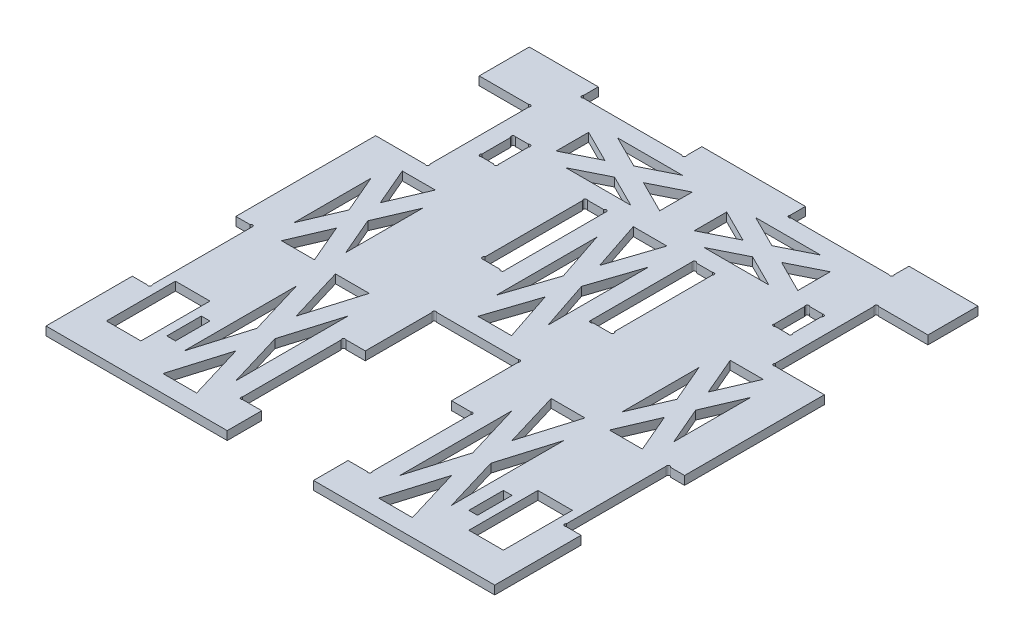
from build123d import *

# Parameters (mm, degrees)
SKETCH1_W           = 330.2
SKETCH1_H           = 355.6
BOSS_EXTRUDE1_DEPTH = 6.35
SKETCH2_W           = 63.5
SKETCH2_H           = 152.4
CUT_EXTRUDE1_DEPTH  = 243.716238641
SKETCH3_W           = 25.4
SKETCH3_H           = 76.2
SKETCH3_W_2         = 12.7
SKETCH3_H_2         = 25.4
CUT_EXTRUDE2_DEPTH  = 243.716238641
SKETCH4_W           = 12.7
SKETCH4_H           = 76.2
SKETCH4_W_2         = 76.2
SKETCH4_H_2         = 12.7
SKETCH4_W_3         = 15.875
CUT_EXTRUDE3_DEPTH  = 243.716238641
SKETCH5_W           = 25.4
SKETCH5_H           = 50.8
SKETCH5_W_2         = 6.35
SKETCH5_H_2         = 25.4
CUT_EXTRUDE4_DEPTH  = 243.716238641
SKETCH6_R           = 1.27
CUT_EXTRUDE5_DEPTH  = 243.716238641


with BuildPart() as part:
    # Sketch1 → Boss-Extrude1 (new body)
    with BuildSketch(Plane(origin=(0, 0, 0), x_dir=(1, 0, 0), z_dir=(0, 1, 0))):
        Rectangle(SKETCH1_W, SKETCH1_H)
    extrude(amount=BOSS_EXTRUDE1_DEPTH)

    # Sketch2 → Cut-Extrude1 (cut, through all)
    with BuildSketch(Plane(origin=(0, 6.35, 0), x_dir=(1, 0, 0), z_dir=(0, 1, 0))):
        with Locations((0, -101.6)):
            Rectangle(SKETCH2_W, SKETCH2_H)
    extrude(amount=-CUT_EXTRUDE1_DEPTH, mode=Mode.SUBTRACT)

    # Sketch3 → Cut-Extrude2 (cut, through all)
    with BuildSketch(Plane(origin=(0, 6.35, 0), x_dir=(1, 0, 0), z_dir=(0, 1, 0))):
        with Locations((139.7, 102.87)):
            Rectangle(SKETCH3_W, SKETCH3_H)
        with Locations((107.95, 102.87)):
            Rectangle(SKETCH3_W_2, SKETCH3_H_2)
        with Locations((-107.95, 102.87)):
            Rectangle(SKETCH3_W_2, SKETCH3_H_2)
        with Locations((-139.7, 102.87)):
            Rectangle(SKETCH3_W, SKETCH3_H)
    extrude(amount=-CUT_EXTRUDE2_DEPTH, mode=Mode.SUBTRACT)

    # Sketch4 → Cut-Extrude3 (cut, through all)
    with BuildSketch(Plane(origin=(0, 6.35, 0), x_dir=(1, 0, 0), z_dir=(0, 1, 0))):
        with Locations((-158.75, 102.87)):
            Rectangle(SKETCH4_W, SKETCH4_H)
        with Locations((-158.75, -76.2)):
            Rectangle(SKETCH4_W, SKETCH4_H)
        with Locations((158.75, 102.87)):
            Rectangle(SKETCH4_W, SKETCH4_H)
        with Locations((158.75, -76.2)):
            Rectangle(SKETCH4_W, SKETCH4_H)
        with Locations((76.2, 171.45)):
            Rectangle(SKETCH4_W_2, SKETCH4_H_2)
        with Locations((-76.2, 171.45)):
            Rectangle(SKETCH4_W_2, SKETCH4_H_2)
        with Locations((-39.6875, -114.3)):
            Rectangle(SKETCH4_W_3, SKETCH4_H)
        with Locations((39.6875, 63.5)):
            Rectangle(SKETCH4_W_3, SKETCH4_H)
        with Locations((-39.6875, 63.5)):
            Rectangle(SKETCH4_W_3, SKETCH4_H)
        with Locations((39.6875, -114.3)):
            Rectangle(SKETCH4_W_3, SKETCH4_H)
    extrude(amount=-CUT_EXTRUDE3_DEPTH, mode=Mode.SUBTRACT)

    # Sketch5 → Cut-Extrude4 (cut, through all)
    with BuildSketch(Plane(origin=(0, 6.35, 0), x_dir=(1, 0, 0), z_dir=(0, 1, 0))):
        Polygon((-79.375, -123.698648777), (-91.795405367, -165.1), (-66.954594633, -165.1), align=None)
        Polygon((-98.425, -60.198648777), (-98.425, -143.001351223), (-86.004594633, -101.6), align=None)
        Polygon((-60.325, -60.198648777), (-72.745405367, -101.6), (-60.325, -143.001351223), align=None)
        Polygon((-91.795405367, -38.1), (-79.375, -79.501351223), (-66.954594633, -38.1), align=None)
        Polygon((-120.65, -8.500053074), (-132.791405825, -36.83), (-108.508594175, -36.83), align=None)
        Polygon((-139.7, 35.949946926), (-139.7, -20.709946926), (-127.558594175, 7.62), align=None)
        Polygon((-101.6, 35.949946926), (-113.741405825, 7.62), (-101.6, -20.709946926), align=None)
        Polygon((-132.791405825, 52.07), (-120.65, 23.740053074), (-108.508594175, 52.07), align=None)
        Polygon((-50.8, 126.250484171), (-74.700968343, 114.3), (-26.899031657, 114.3), align=None)
        Polygon((-88.9, 145.300484171), (-88.9, 121.399515829), (-64.999031657, 133.35), align=None)
        Polygon((-12.7, 145.300484171), (-36.600968343, 133.35), (-12.7, 121.399515829), align=None)
        Polygon((-74.700968343, 152.4), (-50.8, 140.449515829), (-26.899031657, 152.4), align=None)
        Polygon((0, 24.369536858), (-12.356512286, -12.7), (12.356512286, -12.7), align=None)
        Polygon((-19.05, 81.519536858), (-19.05, 7.380463142), (-6.693487714, 44.45), align=None)
        Polygon((19.05, 81.519536858), (6.693487714, 44.45), (19.05, 7.380463142), align=None)
        Polygon((-12.356512286, 101.6), (0, 64.530463142), (12.356512286, 101.6), align=None)
        with Locations((-133.35, -127)):
            Rectangle(SKETCH5_W, SKETCH5_H)
        with Locations((-111.125, -127)):
            Rectangle(SKETCH5_W_2, SKETCH5_H_2)
    cut_extrude4 = extrude(amount=-CUT_EXTRUDE4_DEPTH, mode=Mode.SUBTRACT)

    # Mirror1: Cut-Extrude4 across plane
    add(cut_extrude4.mirror(Plane(origin=(0, 0, 0), x_dir=(0, 0, 1), z_dir=(1, 0, 0))), mode=Mode.SUBTRACT)

    # Sketch6 → Cut-Extrude5 (cut, through all)
    with BuildSketch(Plane(origin=(0, 6.35, 0), x_dir=(1, 0, 0), z_dir=(0, 1, 0))):
        with Locations((-127.819401443, 65.74029958)):
            Circle(SKETCH6_R)
        with Locations((-127.938300971, 140.114142951)):
            Circle(SKETCH6_R)
        with Locations((-113.390747669, 165.986656753)):
            Circle(SKETCH6_R)
        with Locations((-39.124010483, 165.851200727)):
            Circle(SKETCH6_R)
        with Locations((-46.842435984, 100.59975325)):
            Circle(SKETCH6_R)
        with Locations((-32.940336301, 101.157281704)):
            Circle(SKETCH6_R)
        with Locations((-47.298248414, 26.627246268)):
            Circle(SKETCH6_R)
        with Locations((-32.907949838, 25.921586207)):
            Circle(SKETCH6_R)
        with Locations((-153.566823076, -38.601421888)):
            Circle(SKETCH6_R)
        with Locations((-153.151740664, -113.276385828)):
            Circle(SKETCH6_R)
        with Locations((-46.766926853, -151.463725214)):
            Circle(SKETCH6_R)
        with Locations((-46.820773943, -77.182914264)):
            Circle(SKETCH6_R)
        with Locations((-30.885953067, -26.330764684)):
            Circle(SKETCH6_R)
        with Locations((-113.677974461, 114.462758279)):
            Circle(SKETCH6_R)
        with Locations((-102.514812329, 114.689080933)):
            Circle(SKETCH6_R)
        with Locations((-102.638073114, 90.901644865)):
            Circle(SKETCH6_R)
        with Locations((-113.565600374, 91.206126049)):
            Circle(SKETCH6_R)
    cut_extrude5 = extrude(amount=-CUT_EXTRUDE5_DEPTH, mode=Mode.SUBTRACT)

    # Mirror2: Cut-Extrude5 across plane
    add(cut_extrude5.mirror(Plane(origin=(0, 0, 0), x_dir=(0, 0, 1), z_dir=(1, 0, 0))), mode=Mode.SUBTRACT)


solid = part.part
